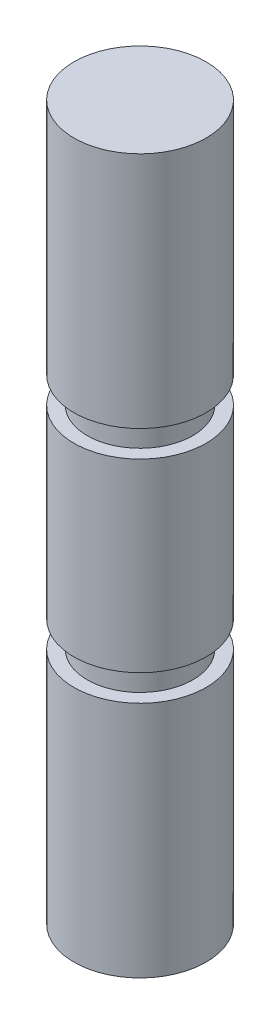
from build123d import *


with BuildPart() as part:
    # 草图1 → 旋转1 (revolve)
    with BuildSketch(Plane(origin=(0, 0, 0), x_dir=(0, 0, -1), z_dir=(1, 0, 0))):
        Polygon((0, 13.5), (2.5, 13.5), (2.5, 4.5), (2, 4.5), (2, 3.5), (2.5, 3.5), (2.5, -3.5), (2, -3.5), (2, -4.5), (2.5, -4.5), (2.5, -13.5), (0, -13.5), align=None)
    revolve(axis=Axis((0, -13.5, 0), (0, 1, 0)))


solid = part.part
